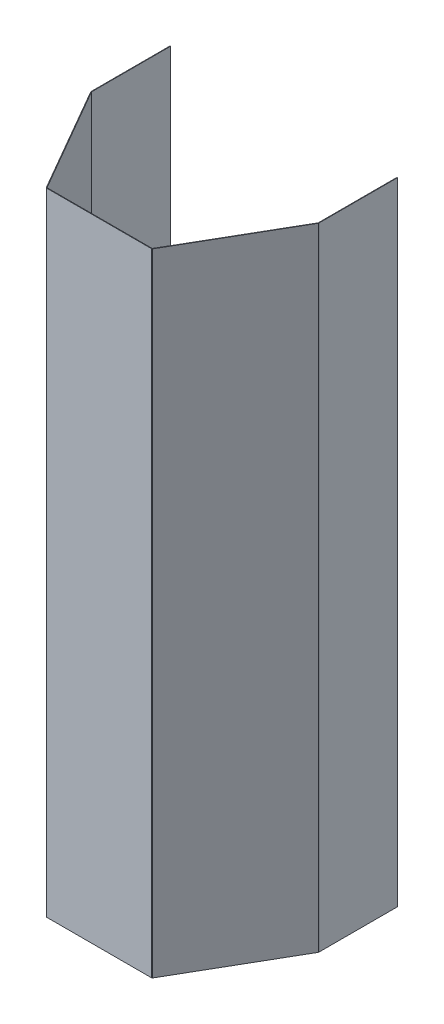
from build123d import *

# Parameters (mm, degrees)
BASE_FLANGE1_DEPTH = 1200


# Sheet-metal steps are written as plain solids
with BuildPart() as part:
    # Sketch3 → Base-Flange1 (new body)
    with BuildSketch(Plane(origin=(0, 0, 0), x_dir=(1, 0, 0), z_dir=(0, 1, 0))):
        with BuildLine():
            Line((-215.470053838, 350), (-215.470053838, 200.197371375))
            ThreePointArc((-215.470053838, 200.197371375), (-215.444954802, 200.006725267), (-215.37136815, 199.829071375))
            Line((-215.37136815, 199.829071375), (-100.212638104, 0.3683))
            ThreePointArc((-100.212638104, 0.3683), (-99.943023792, 0.098685688), (-99.574723792, 0))
            Line((-99.574723792, 0), (99.574723792, 0))
            ThreePointArc((99.574723792, 0), (99.943023792, 0.098685688), (100.212638104, 0.3683))
            Line((100.212638104, 0.3683), (215.37136815, 199.829071375))
            ThreePointArc((215.37136815, 199.829071375), (215.444954802, 200.006725267), (215.470053838, 200.197371375))
            Line((215.470053838, 200.197371375), (215.470053838, 350))
            Line((215.470053838, 350), (216.470053838, 350))
            Line((216.470053838, 350), (216.470053838, 200.197371375))
            ThreePointArc((216.470053838, 200.197371375), (216.410880628, 199.747906221), (216.237393554, 199.329071375))
            Line((216.237393554, 199.329071375), (101.078663508, -0.1317))
            ThreePointArc((101.078663508, -0.1317), (100.443023792, -0.767339716), (99.574723792, -1))
            Line((99.574723792, -1), (-99.574723792, -1))
            ThreePointArc((-99.574723792, -1), (-100.443023792, -0.767339716), (-101.078663508, -0.1317))
            Line((-101.078663508, -0.1317), (-216.237393554, 199.329071375))
            ThreePointArc((-216.237393554, 199.329071375), (-216.410880628, 199.747906221), (-216.470053838, 200.197371375))
            Line((-216.470053838, 200.197371375), (-216.470053838, 350))
            Line((-216.470053838, 350), (-215.470053838, 350))
        make_face()
    extrude(amount=BASE_FLANGE1_DEPTH)


solid = part.part
